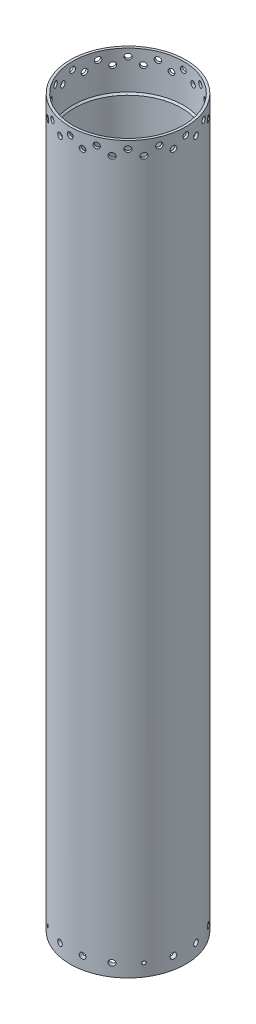
from build123d import *

# Parameters (mm, degrees)
SFAZOWANIE1_SIZE             = 2
SZKIC6_R                     = 3.5
WYTNIJ_WYCI_GNI_CIE2_DEPTH   = 10
SZYK_KO_OWY2_COUNT           = 16
SZKIC4_R                     = 3.5
WYTNIJ_WYCI_GNI_CIE4_DEPTH   = 10
SZYK_KO_OWY3_COUNT           = 16
SZKIC7_R                     = 3.5
WYTNIJ_WYCI_GNI_CIE5_DEPTH   = 10
SZYK_KO_OWY4_COUNT           = 3
SZYK_KO_OWY4_ANGLE           = 45
SZYK_KO_OWY5_COUNT           = 4
SZYK_KO_OWY5_COPY_1_SKETCH_R = 3.5
SZYK_KO_OWY5_COPY_1_DEPTH    = 10
SZYK_KO_OWY5_COPY_2_SKETCH_R = 3.5
SZYK_KO_OWY5_COPY_2_DEPTH    = 10
SZYK_KO_OWY5_COPY_3_SKETCH_R = 3.5
SZYK_KO_OWY5_COPY_3_DEPTH    = 10
SZYK_KO_OWY5_COPY_4_SKETCH_R = 3.5
SZYK_KO_OWY5_COPY_4_DEPTH    = 10
SZYK_KO_OWY5_COPY_5_SKETCH_R = 3.5
SZYK_KO_OWY5_COPY_5_DEPTH    = 10
SZYK_KO_OWY5_COPY_6_SKETCH_R = 3.5
SZYK_KO_OWY5_COPY_6_DEPTH    = 10
SZKIC11_R                    = 2.05
WYTNIJ_WYCI_GNI_CIE6_DEPTH   = 10
SZYK_KO_OWY6_COUNT           = 4


with BuildPart() as part:
    # Szkic1 → Obrót1 (revolve)
    with BuildSketch(Plane.XY, mode=Mode.PRIVATE) as obr_t1_sk:
        Polygon((70, -438.5), (70, 438.5), (67, 438.5), (67, 390.5), (65, 390.5), (65, -438.5), align=None)
    revolve(obr_t1_sk.sketch.rotate(Axis((0, 552.439415296, 0), (0, -1, 0)), 90), axis=Axis((0, 552.439415296, 0), (0, -1, 0)))

    # Sfazowanie1
    sfazowanie1_edges = [part.edges().sort_by_distance(p)[0] for p in [
        (0, 390.5, -67),
    ]]
    chamfer(sfazowanie1_edges, length=SFAZOWANIE1_SIZE - 0.0001)  # a hair under: the kernel refuses the full size

    # Szkic6 → Wytnij-wyciągnięcie2 (cut)
    with BuildSketch(Plane(origin=(-13.656322541, 0, 68.654969628), x_dir=(0, 1, 0), z_dir=(-0.1950903220161221, 0, 0.9807852804032318))):
        with Locations(Location((421.5, 0, 0), (0, 0, 270))):
            Circle(SZKIC6_R)
    wytnij_wyci_gni_cie2 = extrude(amount=-WYTNIJ_WYCI_GNI_CIE2_DEPTH, mode=Mode.SUBTRACT)

    # Szyk kołowy2: Wytnij-wyciągnięcie2 ×16 about axis
    szyk_ko_owy2_axis = Axis((0, 552.439415296, 0), (0, 1, 0))
    for i in range(1, SZYK_KO_OWY2_COUNT):
        add(wytnij_wyci_gni_cie2.rotate(szyk_ko_owy2_axis, i * 360 / SZYK_KO_OWY2_COUNT), mode=Mode.SUBTRACT)

    # Szkic4 → Wytnij-wyciągnięcie4 (cut)
    with BuildSketch(Plane.XY.offset(70)):
        with Locations(Location((0, 429.5, 0), (0, 0, 270))):
            Circle(SZKIC4_R)
    wytnij_wyci_gni_cie4 = extrude(amount=-WYTNIJ_WYCI_GNI_CIE4_DEPTH, mode=Mode.SUBTRACT)

    # Szyk kołowy3: Wytnij-wyciągnięcie4 ×16 about axis
    szyk_ko_owy3_axis = Axis((0, 552.439415296, 0), (0, 1, 0))
    for i in range(1, SZYK_KO_OWY3_COUNT):
        add(wytnij_wyci_gni_cie4.rotate(szyk_ko_owy3_axis, i * 360 / SZYK_KO_OWY3_COUNT), mode=Mode.SUBTRACT)

    # Szkic7 → Wytnij-wyciągnięcie5 (cut)
    with BuildSketch(Plane(origin=(-13.656322541, 0, 68.654969628), x_dir=(0, 1, 0), z_dir=(-0.1950903220161221, 0, 0.9807852804032318))):
        with Locations(Location((-423.5, 0, 0), (0, 0, 270))):
            Circle(SZKIC7_R)
    wytnij_wyci_gni_cie5 = extrude(amount=-WYTNIJ_WYCI_GNI_CIE5_DEPTH, mode=Mode.SUBTRACT)

    # Szyk kołowy4: Wytnij-wyciągnięcie5 ×3 about axis
    szyk_ko_owy4_axis = Axis((0, 552.439415296, 0), (0, 1, 0))
    for i in range(1, SZYK_KO_OWY4_COUNT):
        add(wytnij_wyci_gni_cie5.rotate(szyk_ko_owy4_axis, i * SZYK_KO_OWY4_ANGLE / (SZYK_KO_OWY4_COUNT - 1)), mode=Mode.SUBTRACT)

    # Szyk kołowy5: Wytnij-wyciągnięcie5 ×4 about axis
    szyk_ko_owy5_axis = Axis((0, 552.439415296, 0), (0, 1, 0))
    for i in range(1, SZYK_KO_OWY5_COUNT):
        add(wytnij_wyci_gni_cie5.rotate(szyk_ko_owy5_axis, i * 360 / SZYK_KO_OWY5_COUNT), mode=Mode.SUBTRACT)

    # Szyk kołowy5 copy 1 sketch → Szyk kołowy5 copy 1 (cut)
    with BuildSketch(Plane(origin=(68.654969628, 0, -13.656322541), x_dir=(0, 1, 0), z_dir=(0.9807852804032291, 0, -0.19509032201613527))):
        with Locations(Location((-423.5, 0, 0), (0, 0, 270))):
            Circle(SZYK_KO_OWY5_COPY_1_SKETCH_R)
    extrude(amount=-SZYK_KO_OWY5_COPY_1_DEPTH, mode=Mode.SUBTRACT)

    # Szyk kołowy5 copy 2 sketch → Szyk kołowy5 copy 2 (cut)
    with BuildSketch(Plane(origin=(-13.656322541, 0, -68.654969628), x_dir=(0, 1, 0), z_dir=(-0.19509032201613521, 0, -0.9807852804032291))):
        with Locations(Location((-423.5, 0, 0), (0, 0, 270))):
            Circle(SZYK_KO_OWY5_COPY_2_SKETCH_R)
    extrude(amount=-SZYK_KO_OWY5_COPY_2_DEPTH, mode=Mode.SUBTRACT)

    # Szyk kołowy5 copy 3 sketch → Szyk kołowy5 copy 3 (cut)
    with BuildSketch(Plane(origin=(-68.654969628, 0, 13.656322541), x_dir=(0, 1, 0), z_dir=(-0.9807852804032291, 0, 0.19509032201613513))):
        with Locations(Location((-423.5, 0, 0), (0, 0, 270))):
            Circle(SZYK_KO_OWY5_COPY_3_SKETCH_R)
    extrude(amount=-SZYK_KO_OWY5_COPY_3_DEPTH, mode=Mode.SUBTRACT)

    # Szyk kołowy5 copy 4 sketch → Szyk kołowy5 copy 4 (cut)
    with BuildSketch(Plane(origin=(58.202872861, 0, -38.889916311), x_dir=(0, 1, 0), z_dir=(0.8314696123025408, 0, -0.555570233019609))):
        with Locations(Location((-423.5, 0, 0), (0, 0, 270))):
            Circle(SZYK_KO_OWY5_COPY_4_SKETCH_R)
    extrude(amount=-SZYK_KO_OWY5_COPY_4_DEPTH, mode=Mode.SUBTRACT)

    # Szyk kołowy5 copy 5 sketch → Szyk kołowy5 copy 5 (cut)
    with BuildSketch(Plane(origin=(-38.889916311, 0, -58.202872861), x_dir=(0, 1, 0), z_dir=(-0.5555702330196088, 0, -0.8314696123025409))):
        with Locations(Location((-423.5, 0, 0), (0, 0, 270))):
            Circle(SZYK_KO_OWY5_COPY_5_SKETCH_R)
    extrude(amount=-SZYK_KO_OWY5_COPY_5_DEPTH, mode=Mode.SUBTRACT)

    # Szyk kołowy5 copy 6 sketch → Szyk kołowy5 copy 6 (cut)
    with BuildSketch(Plane(origin=(-58.202872861, 0, 38.889916311), x_dir=(0, 1, 0), z_dir=(-0.8314696123025409, 0, 0.5555702330196088))):
        with Locations(Location((-423.5, 0, 0), (0, 0, 270))):
            Circle(SZYK_KO_OWY5_COPY_6_SKETCH_R)
    extrude(amount=-SZYK_KO_OWY5_COPY_6_DEPTH, mode=Mode.SUBTRACT)

    # Szkic11 → Wytnij-wyciągnięcie6 (cut)
    with BuildSketch(Plane(origin=(-58.202872861, 0, -38.889916311), x_dir=(0, 1, 0), z_dir=(-0.8314696123025503, 0, -0.5555702330195949))):
        with Locations(Location((-423.5, 0, 0), (0, 0, 270))):
            Circle(SZKIC11_R)
    wytnij_wyci_gni_cie6 = extrude(amount=-WYTNIJ_WYCI_GNI_CIE6_DEPTH, mode=Mode.SUBTRACT)

    # Szyk kołowy6: Wytnij-wyciągnięcie6 ×4 about axis
    szyk_ko_owy6_axis = Axis((0, 552.439415296, 0), (0, 1, 0))
    for i in range(1, SZYK_KO_OWY6_COUNT):
        add(wytnij_wyci_gni_cie6.rotate(szyk_ko_owy6_axis, i * 360 / SZYK_KO_OWY6_COUNT), mode=Mode.SUBTRACT)


solid = part.part
